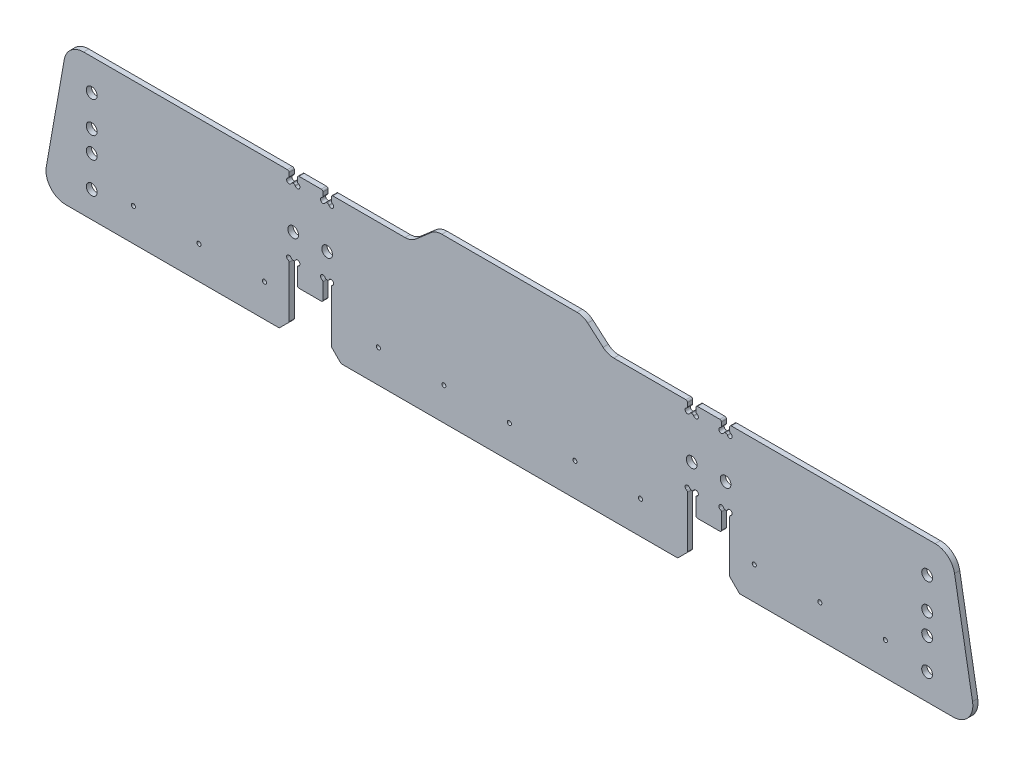
from build123d import *

# Parameters (mm, degrees)
SKETCH1_W               = 540
SKETCH1_H               = 86.2
BOSS_EXTRUDE1_DEPTH     = 3.175
SKETCH2_W               = 25.75
SKETCH2_H               = 40
CUT_EXTRUDE1_DEPTH      = 274.436812856
F_1_4_CLEARANCE_HOLE1_D = 6.5278
DRAFT1_ANGLE            = 10
FILLET1_R               = 12
CHAMFER1_SIZE           = 6
SKETCH5_R               = 3.3
CUT_EXTRUDE2_DEPTH      = 287.180297864
BOSS_EXTRUDE2_DEPTH     = 3.175
FILLET2_R               = 10
SKETCH8_W               = 15.55
SKETCH8_H               = 13
BOSS_EXTRUDE3_DEPTH     = 3.175
SKETCH9_R               = 1.5
CUT_EXTRUDE3_DEPTH      = 289.424622537
FILLET3_R               = 1
SKETCH10_W              = 5.1
SKETCH10_H              = 5.5
CUT_EXTRUDE4_DEPTH      = 289.424622537
SKETCH11_R              = 1.5
CUT_EXTRUDE5_DEPTH      = 289.424622537
FILLET4_R               = 1
M3X0_5_TAPPED_HOLE1_D   = 2.5


with BuildPart() as part:
    # Sketch1 → Boss-Extrude1 (new body)
    with BuildSketch(Plane.XY):
        Rectangle(SKETCH1_W, SKETCH1_H)
    extrude(amount=BOSS_EXTRUDE1_DEPTH)

    # Sketch2 → Cut-Extrude1 (cut, through all)
    with BuildSketch(Plane.XY.offset(3.175)):
        with Locations((121.62, -23.1)):
            Rectangle(SKETCH2_W, SKETCH2_H)
        with Locations((-121.62, -23.1)):
            Rectangle(SKETCH2_W, SKETCH2_H)
    extrude(amount=-CUT_EXTRUDE1_DEPTH, mode=Mode.SUBTRACT)

    # 1/4 Clearance Hole1 (through all)
    with Locations(Plane.XY.offset(3.175)):
        with Locations((-131.975, 11.9), (-111.265, 11.9), (111.265, 11.9), (131.975, 11.9)):
            Hole(F_1_4_CLEARANCE_HOLE1_D / 2)

    # Draft1
    draft1_faces = [part.faces().sort_by_distance(p)[0] for p in [
        (270, 0, 1.5875),
        (-270, 0, 1.5875),
    ]]
    draft(draft1_faces, Plane(origin=(270, 43.1, 3.175), x_dir=(1, 0, 0), z_dir=(0, 1, 0)), DRAFT1_ANGLE)

    # Fillet1
    fillet1_edges = [part.edges().sort_by_distance(p)[0] for p in [
        (-285.199385737, -43.1, 1.5875),
        (-270, 43.1, 1.5875),
        (270, 43.1, 1.5875),
        (285.199385737, -43.1, 1.5875),
    ]]
    fillet(fillet1_edges, radius=FILLET1_R)

    # Chamfer1
    chamfer1_edges = [part.edges().sort_by_distance(p)[0] for p in [
        (-134.495, -43.1, 1.5875),
        (134.495, -43.1, 1.5875),
        (108.745, -43.1, 1.5875),
        (-108.745, -43.1, 1.5875),
    ]]
    chamfer(chamfer1_edges, length=CHAMFER1_SIZE)

    # Sketch5 → Cut-Extrude2 (cut, through all)
    with BuildSketch(Plane(origin=(0, 0, 0), x_dir=(-1, 0, 0), z_dir=(0, 0, -1))):
        with Locations((-255, 24)):
            Circle(SKETCH5_R)
        with Locations((-255, 4.95)):
            Circle(SKETCH5_R)
        with Locations((-255, -8.05)):
            Circle(SKETCH5_R)
        with Locations((-255, -27.1)):
            Circle(SKETCH5_R)
        with Locations(Location((255, -27.1, 0), (0, 0, 180))):
            Circle(SKETCH5_R)
        with Locations(Location((255, -8.05, 0), (0, 0, 180))):
            Circle(SKETCH5_R)
        with Locations(Location((255, 4.95, 0), (0, 0, 180))):
            Circle(SKETCH5_R)
        with Locations(Location((255, 24, 0), (0, 0, 180))):
            Circle(SKETCH5_R)
    extrude(amount=-CUT_EXTRUDE2_DEPTH, mode=Mode.SUBTRACT)

    # Sketch6 → Boss-Extrude2 (add)
    with BuildSketch(Plane.XY.offset(3.175)):
        Polygon((-60, 43.1), (-45, 56.1), (45, 56.1), (60, 43.1), align=None)
    extrude(amount=-BOSS_EXTRUDE2_DEPTH)

    # Fillet2
    fillet2_edges = [part.edges().sort_by_distance(p)[0] for p in [
        (60, 43.1, 1.5875),
        (-60, 43.1, 1.5875),
        (-45, 56.1, 1.5875),
        (45, 56.1, 1.5875),
    ]]
    fillet(fillet2_edges, radius=FILLET2_R)

    # Sketch8 → Boss-Extrude3 (add)
    with BuildSketch(Plane.XY.offset(3.175)):
        with Locations((-121.62, -9.6)):
            Rectangle(SKETCH8_W, SKETCH8_H)
        with Locations((121.62, -9.6)):
            Rectangle(SKETCH8_W, SKETCH8_H)
    extrude(amount=-BOSS_EXTRUDE3_DEPTH)

    # Sketch9 → Cut-Extrude3 (cut, through all)
    with BuildSketch(Plane.XY.offset(3.175)):
        with Locations((-134.495, -3.1)):
            Circle(SKETCH9_R)
        with Locations((-129.395, -3.1)):
            Circle(SKETCH9_R)
        with Locations((-113.845, -3.1)):
            Circle(SKETCH9_R)
        with Locations((-108.745, -3.1)):
            Circle(SKETCH9_R)
        with Locations((113.845, -3.1)):
            Circle(SKETCH9_R)
        with Locations((108.745, -3.1)):
            Circle(SKETCH9_R)
        with Locations((134.495, -3.1)):
            Circle(SKETCH9_R)
        with Locations((129.395, -3.1)):
            Circle(SKETCH9_R)
    extrude(amount=-CUT_EXTRUDE3_DEPTH, mode=Mode.SUBTRACT)

    # Fillet3
    fillet3_edges = [part.edges().sort_by_distance(p)[0] for p in [
        (-129.395, -16.1, 1.5875),
        (-113.845, -16.1, 1.5875),
        (113.845, -16.1, 1.5875),
        (129.395, -16.1, 1.5875),
        (129.395, -4.6, 1.5875),
        (113.845, -4.6, 1.5875),
        (-113.845, -4.6, 1.5875),
        (-129.395, -4.6, 1.5875),
        (-132.995, -3.1, 1.5875),
        (-134.495, -4.6, 1.5875),
        (110.245, -3.1, 1.5875),
        (108.745, -4.6, 1.5875),
        (132.995, -3.1, 1.5875),
        (134.495, -4.6, 1.5875),
        (130.895, -3.1, 1.5875),
        (112.345, -3.1, 1.5875),
        (-108.745, -4.6, 1.5875),
        (-110.245, -3.1, 1.5875),
        (-112.345, -3.1, 1.5875),
        (-130.895, -3.1, 1.5875),
        (-140.495, -43.1, 1.5875),
        (-134.495, -37.1, 1.5875),
        (-108.745, -37.1, 1.5875),
        (102.745, -43.1, 1.5875),
        (-102.745, -43.1, 1.5875),
        (134.495, -37.1, 1.5875),
        (140.495, -43.1, 1.5875),
        (108.745, -37.1, 1.5875),
    ]]
    fillet(fillet3_edges, radius=FILLET3_R)

    # Sketch10 → Cut-Extrude4 (cut, through all)
    with BuildSketch(Plane.XY.offset(3.175)):
        with Locations((-131.945, 40.35)):
            Rectangle(SKETCH10_W, SKETCH10_H)
        with Locations((-111.295, 40.35)):
            Rectangle(SKETCH10_W, SKETCH10_H)
        with Locations((111.295, 40.35)):
            Rectangle(SKETCH10_W, SKETCH10_H)
        with Locations((131.945, 40.35)):
            Rectangle(SKETCH10_W, SKETCH10_H)
    extrude(amount=-CUT_EXTRUDE4_DEPTH, mode=Mode.SUBTRACT)

    # Sketch11 → Cut-Extrude5 (cut, through all)
    with BuildSketch(Plane.XY.offset(3.175)):
        with Locations((-134.495, 37.6)):
            Circle(SKETCH11_R)
        with Locations((-129.395, 37.6)):
            Circle(SKETCH11_R)
        with Locations((-113.845, 37.6)):
            Circle(SKETCH11_R)
        with Locations((-108.745, 37.6)):
            Circle(SKETCH11_R)
        with Locations((113.845, 37.6)):
            Circle(SKETCH11_R)
        with Locations((108.745, 37.6)):
            Circle(SKETCH11_R)
        with Locations((129.395, 37.6)):
            Circle(SKETCH11_R)
        with Locations((134.495, 37.6)):
            Circle(SKETCH11_R)
    extrude(amount=-CUT_EXTRUDE5_DEPTH, mode=Mode.SUBTRACT)

    # Fillet4
    fillet4_edges = [part.edges().sort_by_distance(p)[0] for p in [
        (-134.495, 43.1, 1.5875),
        (-129.395, 43.1, 1.5875),
        (-113.845, 43.1, 1.5875),
        (-108.745, 43.1, 1.5875),
        (108.745, 43.1, 1.5875),
        (113.845, 43.1, 1.5875),
        (129.395, 43.1, 1.5875),
        (134.495, 43.1, 1.5875),
        (-130.895, 37.6, 1.5875),
        (-132.995, 37.6, 1.5875),
        (-112.345, 37.6, 1.5875),
        (-110.245, 37.6, 1.5875),
        (108.745, 39.1, 1.5875),
        (112.345, 37.6, 1.5875),
        (129.395, 39.1, 1.5875),
        (132.995, 37.6, 1.5875),
        (-134.495, 39.1, 1.5875),
        (134.495, 39.1, 1.5875),
        (130.895, 37.6, 1.5875),
        (110.245, 37.6, 1.5875),
        (113.845, 39.1, 1.5875),
        (-108.745, 39.1, 1.5875),
        (-113.845, 39.1, 1.5875),
        (-129.395, 39.1, 1.5875),
    ]]
    fillet(fillet4_edges, radius=FILLET4_R)

    # M3x0.5 Tapped Hole1 (through all)
    with Locations(Plane(origin=(0, 0, 0), x_dir=(-1, 0, 0), z_dir=(0, 0, -1))):
        with Locations((-229.495, -23.1), (-189.495, -23.1), (-149.495, -23.1), (-80, -23.1), (-40, -23.1), (0, -23.1), (40, -23.1), (80, -23.1), (149.495, -23.1), (189.495, -23.1), (229.495, -23.1)):
            Hole(M3X0_5_TAPPED_HOLE1_D / 2)


solid = part.part
